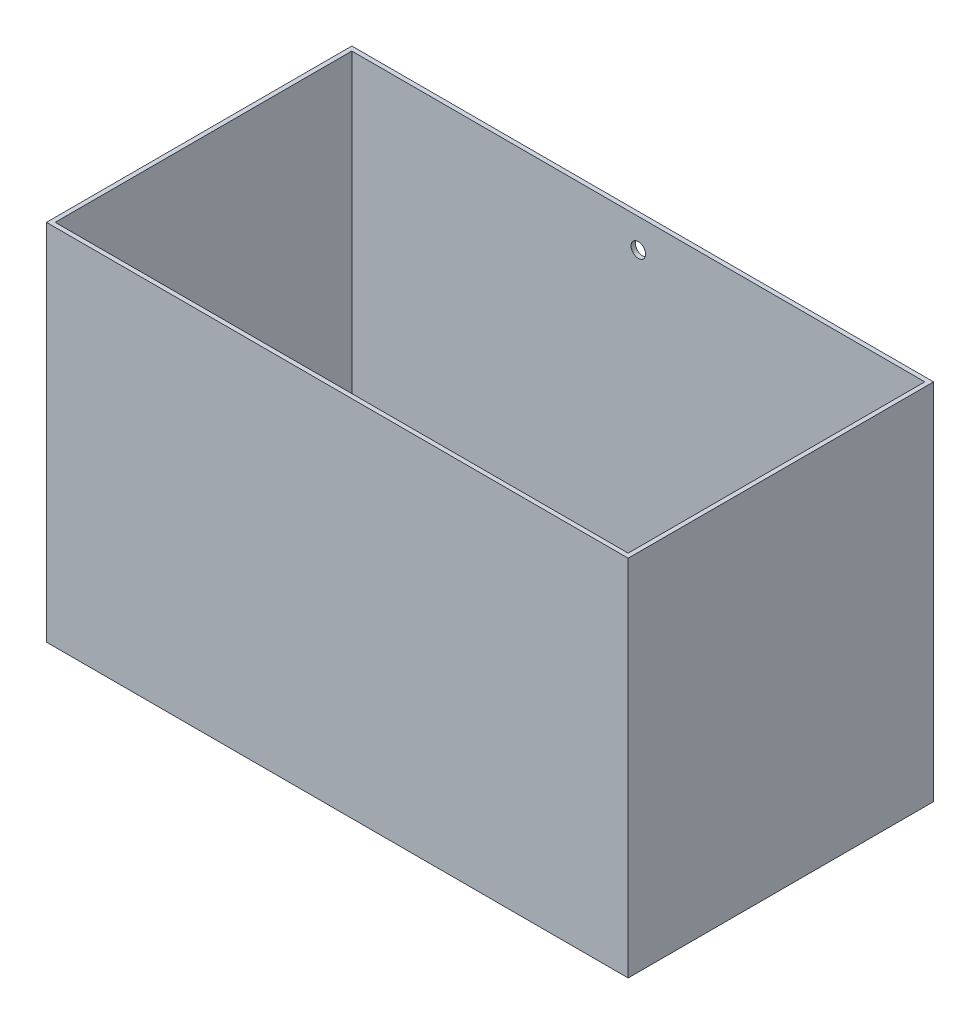
from build123d import *

# Parameters (mm, degrees)
SKETCH1_W           = 400
SKETCH1_H           = 210
SKETCH1_W_2         = 394
SKETCH1_H_2         = 204
EXTRUDE_THIN1_DEPTH = 250
SKETCH4_R           = 5
CUT_EXTRUDE1_DEPTH  = 10


with BuildPart() as part:
    # Sketch1 → Extrude-Thin1 (new body)
    with BuildSketch(Plane(origin=(0, 0, 0), x_dir=(1, 0, 0), z_dir=(0, 1, 0))):
        with Locations((200, -105)):
            Rectangle(SKETCH1_W, SKETCH1_H)
        with Locations((200, -105)):
            Rectangle(SKETCH1_W_2, SKETCH1_H_2, mode=Mode.SUBTRACT)
    extrude(amount=EXTRUDE_THIN1_DEPTH)

    # Sketch4 → Cut-Extrude1 (cut)
    with BuildSketch(Plane(origin=(0, 0, 0), x_dir=(-1, 0, 0), z_dir=(0, 0, -1))):
        with Locations((-200, 230)):
            Circle(SKETCH4_R)
    extrude(amount=-CUT_EXTRUDE1_DEPTH, mode=Mode.SUBTRACT)


solid = part.part
